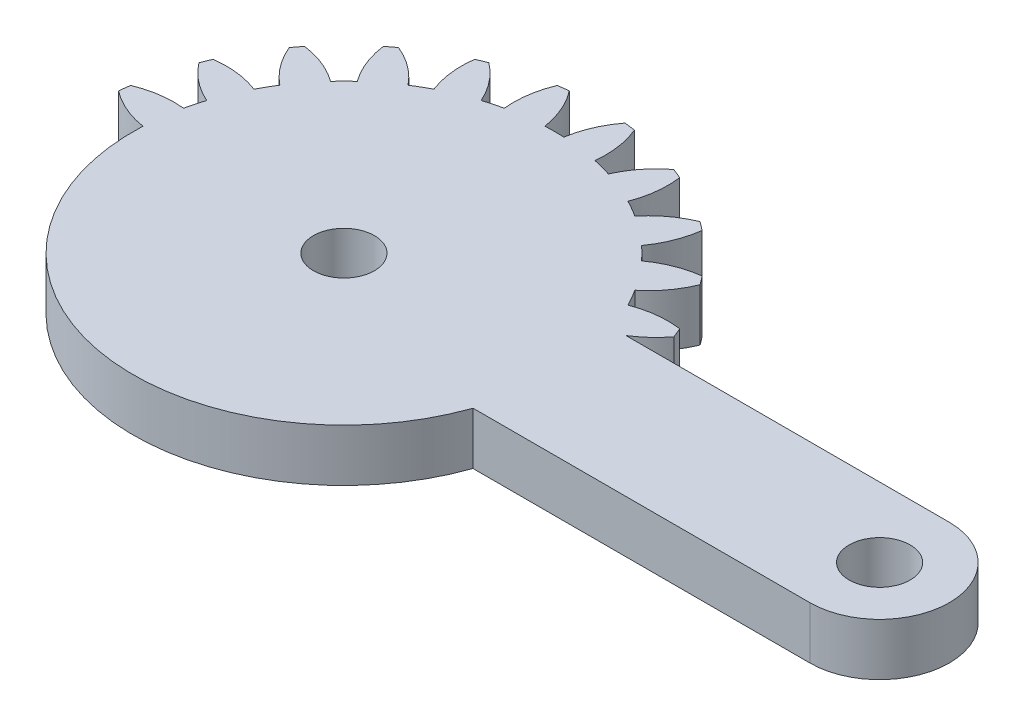
from build123d import *
from build123d.topology import SkipClean

# Parameters (mm, degrees)
SKETCH1_R           = 1.75
BOSS_EXTRUDE1_DEPTH = 3
CUT_EXTRUDE1_START  = -10
CUT_EXTRUDE1_DEPTH  = 10


with BuildPart() as part:
    # Sketch1 → Boss-Extrude1 (new body)
    with BuildSketch(Plane(origin=(0, 0, 0), x_dir=(1, 0, 0), z_dir=(0, 1, 0))):
        with BuildLine():
            Line((20.643657446, 4), (2.081641936, 4))
            ThreePointArc((2.081641936, 4), (2.861028333, 4.588201733), (3.521749436, 5.30713988))
            ThreePointArc((3.521749436, 5.30713988), (3.405395609, 5.596745198), (3.282888305, 5.883801663))
            ThreePointArc((3.282888305, 5.883801663), (1.93527598, 5.894040025), (0.627094961, 5.57027124))
            ThreePointArc((0.627094961, 5.57027124), (0.366286148, 6.046375), (0.084372603, 6.510293938))
            ThreePointArc((0.084372603, 6.510293938), (1.018855105, 7.48132754), (1.683794586, 8.65351323))
            ThreePointArc((1.683794586, 8.65351323), (1.496450048, 8.903135899), (1.303821399, 9.148703928))
            ThreePointArc((1.303821399, 9.148703928), (-0.000522033, 8.809805691), (-1.180330337, 8.158486898))
            ThreePointArc((-1.180330337, 8.158486898), (-1.555477026, 8.550865528), (-1.947855656, 8.926012217))
            ThreePointArc((-1.947855656, 8.926012217), (-1.296536862, 10.105820521), (-0.957638625, 11.410163953))
            ThreePointArc((-0.957638625, 11.410163953), (-1.203206655, 11.602792602), (-1.452829324, 11.79013714))
            ThreePointArc((-1.452829324, 11.79013714), (-2.625015014, 11.125197659), (-3.596048616, 10.190715157))
            ThreePointArc((-3.596048616, 10.190715157), (-4.059967554, 10.472628702), (-4.536071314, 10.733437515))
            ThreePointArc((-4.536071314, 10.733437515), (-4.212302529, 12.041618533), (-4.222540891, 13.389230859))
            ThreePointArc((-4.222540891, 13.389230859), (-4.509597355, 13.511738163), (-4.799202674, 13.62809199))
            ThreePointArc((-4.799202674, 13.62809199), (-5.759348103, 12.682425791), (-6.455432668, 11.528463019))
            ThreePointArc((-6.455432668, 11.528463019), (-6.976508546, 11.680699536), (-7.503891752, 11.809396783))
            ThreePointArc((-7.503891752, 11.809396783), (-7.529737283, 13.156800143), (-7.888414517, 14.455843809))
            ThreePointArc((-7.888414517, 14.455843809), (-8.197396993, 14.499881098), (-8.507248835, 14.537314892))
            ThreePointArc((-8.507248835, 14.537314892), (-9.18992168, 13.375367565), (-9.563620196, 12.080565177))
            ThreePointArc((-9.563620196, 12.080565177), (-10.106342554, 12.09275), (-10.649064912, 12.080565177))
            ThreePointArc((-10.649064912, 12.080565177), (-11.022763428, 13.375367565), (-11.705436272, 14.537314892))
            ThreePointArc((-11.705436272, 14.537314892), (-12.015288115, 14.499881098), (-12.324270591, 14.455843809))
            ThreePointArc((-12.324270591, 14.455843809), (-12.682947825, 13.156800143), (-12.708793355, 11.809396783))
            ThreePointArc((-12.708793355, 11.809396783), (-13.236176561, 11.680699536), (-13.757252439, 11.528463019))
            ThreePointArc((-13.757252439, 11.528463019), (-14.453337005, 12.682425791), (-15.413482434, 13.62809199))
            ThreePointArc((-15.413482434, 13.62809199), (-15.703087752, 13.511738163), (-15.990144217, 13.389230859))
            ThreePointArc((-15.990144217, 13.389230859), (-16.000382579, 12.041618533), (-15.676613793, 10.733437515))
            ThreePointArc((-15.676613793, 10.733437515), (-16.152717554, 10.472628702), (-16.616636492, 10.190715157))
            ThreePointArc((-16.616636492, 10.190715157), (-17.587670094, 11.125197659), (-18.759855783, 11.79013714))
            ThreePointArc((-18.759855783, 11.79013714), (-19.009478453, 11.602792602), (-19.255046482, 11.410163953))
            ThreePointArc((-19.255046482, 11.410163953), (-18.916148245, 10.105820521), (-18.264829452, 8.926012217))
            ThreePointArc((-18.264829452, 8.926012217), (-18.657208082, 8.550865528), (-19.032354771, 8.158486898))
            ThreePointArc((-19.032354771, 8.158486898), (-20.212163074, 8.809805691), (-21.516506507, 9.148703928))
            ThreePointArc((-21.516506507, 9.148703928), (-21.709135156, 8.903135899), (-21.896479694, 8.65351323))
            ThreePointArc((-21.896479694, 8.65351323), (-21.231540213, 7.48132754), (-20.297057711, 6.510293938))
            ThreePointArc((-20.297057711, 6.510293938), (-20.578971255, 6.046375), (-20.839780068, 5.57027124))
            ThreePointArc((-20.839780068, 5.57027124), (-22.147961087, 5.894040025), (-23.495573413, 5.883801663))
            ThreePointArc((-23.495573413, 5.883801663), (-23.618080717, 5.596745198), (-23.734434544, 5.30713988))
            ThreePointArc((-23.734434544, 5.30713988), (-22.788768345, 4.346994451), (-21.634805572, 3.650909885))
            ThreePointArc((-21.634805572, 3.650909885), (-21.78704209, 3.129834008), (-21.915739337, 2.602450802))
            ThreePointArc((-21.915739337, 2.602450802), (-23.263142697, 2.576605271), (-24.562186363, 2.217928037))
            ThreePointArc((-24.562186363, 2.217928037), (-24.606223651, 1.908945561), (-24.643657446, 1.599093719))
            ThreePointArc((-24.643657446, 1.599093719), (-23.481710119, 0.916420874), (-22.186907731, 0.542722358))
            ThreePointArc((-22.186907731, 0.542722358), (-22.199092554, 0), (-22.186907731, -0.542722358))
            ThreePointArc((-22.186907731, -0.542722358), (-23.481710119, -0.916420874), (-24.643657446, -1.599093719))
            ThreePointArc((-24.643657446, -1.599093719), (-24.606223651, -1.908945561), (-24.562186363, -2.217928037))
            ThreePointArc((-24.562186363, -2.217928037), (-23.263142697, -2.576605271), (-21.915739337, -2.602450802))
            ThreePointArc((-21.915739337, -2.602450802), (-21.78704209, -3.129834008), (-21.634805572, -3.650909885))
            ThreePointArc((-21.634805572, -3.650909885), (-22.788768345, -4.346994451), (-23.734434544, -5.30713988))
            ThreePointArc((-23.734434544, -5.30713988), (-23.618080717, -5.596745198), (-23.495573413, -5.883801663))
            ThreePointArc((-23.495573413, -5.883801663), (-22.147961087, -5.894040025), (-20.839780068, -5.57027124))
            ThreePointArc((-20.839780068, -5.57027124), (-20.578971255, -6.046375), (-20.297057711, -6.510293938))
            ThreePointArc((-20.297057711, -6.510293938), (-21.231540213, -7.48132754), (-21.896479694, -8.65351323))
            ThreePointArc((-21.896479694, -8.65351323), (-21.709135156, -8.903135899), (-21.516506507, -9.148703928))
            ThreePointArc((-21.516506507, -9.148703928), (-20.212163074, -8.809805691), (-19.032354771, -8.158486898))
            ThreePointArc((-19.032354771, -8.158486898), (-18.657208082, -8.550865528), (-18.264829452, -8.926012217))
            ThreePointArc((-18.264829452, -8.926012217), (-18.916148245, -10.105820521), (-19.255046482, -11.410163953))
            ThreePointArc((-19.255046482, -11.410163953), (-19.009478453, -11.602792602), (-18.759855783, -11.79013714))
            ThreePointArc((-18.759855783, -11.79013714), (-17.587670094, -11.125197659), (-16.616636492, -10.190715157))
            ThreePointArc((-16.616636492, -10.190715157), (-16.152717554, -10.472628702), (-15.676613793, -10.733437515))
            ThreePointArc((-15.676613793, -10.733437515), (-16.000382579, -12.041618533), (-15.990144217, -13.389230859))
            ThreePointArc((-15.990144217, -13.389230859), (-15.703087752, -13.511738163), (-15.413482434, -13.62809199))
            ThreePointArc((-15.413482434, -13.62809199), (-14.453337005, -12.682425791), (-13.757252439, -11.528463019))
            ThreePointArc((-13.757252439, -11.528463019), (-13.236176561, -11.680699536), (-12.708793355, -11.809396783))
            ThreePointArc((-12.708793355, -11.809396783), (-12.682947825, -13.156800143), (-12.324270591, -14.455843809))
            ThreePointArc((-12.324270591, -14.455843809), (-12.015288115, -14.499881098), (-11.705436272, -14.537314892))
            ThreePointArc((-11.705436272, -14.537314892), (-11.022763428, -13.375367565), (-10.649064912, -12.080565177))
            ThreePointArc((-10.649064912, -12.080565177), (-10.106342554, -12.09275), (-9.563620196, -12.080565177))
            ThreePointArc((-9.563620196, -12.080565177), (-9.18992168, -13.375367565), (-8.507248835, -14.537314892))
            ThreePointArc((-8.507248835, -14.537314892), (-8.197396993, -14.499881098), (-7.888414517, -14.455843809))
            ThreePointArc((-7.888414517, -14.455843809), (-7.529737283, -13.156800143), (-7.503891752, -11.809396783))
            ThreePointArc((-7.503891752, -11.809396783), (-6.976508546, -11.680699536), (-6.455432668, -11.528463019))
            ThreePointArc((-6.455432668, -11.528463019), (-5.759348103, -12.682425791), (-4.799202674, -13.62809199))
            ThreePointArc((-4.799202674, -13.62809199), (-4.509597355, -13.511738163), (-4.222540891, -13.389230859))
            ThreePointArc((-4.222540891, -13.389230859), (-4.212302529, -12.041618533), (-4.536071314, -10.733437515))
            ThreePointArc((-4.536071314, -10.733437515), (-4.059967554, -10.472628702), (-3.596048616, -10.190715157))
            ThreePointArc((-3.596048616, -10.190715157), (-2.625015014, -11.125197659), (-1.452829324, -11.79013714))
            ThreePointArc((-1.452829324, -11.79013714), (-1.203206655, -11.602792602), (-0.957638625, -11.410163953))
            ThreePointArc((-0.957638625, -11.410163953), (-1.296536862, -10.105820521), (-1.947855656, -8.926012217))
            ThreePointArc((-1.947855656, -8.926012217), (-1.555477026, -8.550865528), (-1.180330337, -8.158486898))
            ThreePointArc((-1.180330337, -8.158486898), (-0.000522033, -8.809805691), (1.303821399, -9.148703928))
            ThreePointArc((1.303821399, -9.148703928), (1.496450048, -8.903135899), (1.683794586, -8.65351323))
            ThreePointArc((1.683794586, -8.65351323), (1.018855105, -7.48132754), (0.084372603, -6.510293938))
            ThreePointArc((0.084372603, -6.510293938), (0.366286148, -6.046375), (0.627094961, -5.57027124))
            ThreePointArc((0.627094961, -5.57027124), (1.93527598, -5.894040025), (3.282888305, -5.883801663))
            ThreePointArc((3.282888305, -5.883801663), (3.405395609, -5.596745198), (3.521749436, -5.30713988))
            ThreePointArc((3.521749436, -5.30713988), (2.861028333, -4.588201733), (2.081641936, -4))
            Line((2.081641936, -4), (20.643657446, -4))
            ThreePointArc((20.643657446, -4), (24.643657446, 0), (20.643657446, 4))
        make_face()
        with Locations((-10.106342554, 0)):
            Circle(SKETCH1_R, mode=Mode.SUBTRACT)
        with Locations((20.643657446, 0)):
            Circle(SKETCH1_R, mode=Mode.SUBTRACT)
    extrude(amount=BOSS_EXTRUDE1_DEPTH)

    # Sketch2 → Cut-Extrude1 (cut)
    with SkipClean():  # the faces are left unmerged after this step: merging them gives an invalid solid
        with BuildSketch(Plane(origin=(0, 3, 0), x_dir=(1, 0, 0), z_dir=(0, 1, 0)).offset(CUT_EXTRUDE1_START)):
            with BuildLine():
                ThreePointArc((3.521749436, -5.30713988), (2.861028333, -4.588201733), (2.081641936, -4))
                Line((2.081641936, -4), (1.305695063, -4))
                ThreePointArc((1.305695063, -4), (0.994195953, -4.797149927), (0.627094961, -5.57027124))
                ThreePointArc((0.627094961, -5.57027124), (1.93527598, -5.894040025), (3.282888305, -5.883801663))
                ThreePointArc((3.282888305, -5.883801663), (3.405395609, -5.596745198), (3.521749436, -5.30713988))
            make_face()
            with BuildLine():
                ThreePointArc((1.683794586, -8.65351323), (1.018855105, -7.48132754), (0.084372603, -6.510293938))
                ThreePointArc((0.084372603, -6.510293938), (-0.512518948, -7.361599771), (-1.180330337, -8.158486898))
                ThreePointArc((-1.180330337, -8.158486898), (-0.000522033, -8.809805691), (1.303821399, -9.148703928))
                ThreePointArc((1.303821399, -9.148703928), (1.496450048, -8.903135899), (1.683794586, -8.65351323))
            make_face()
            with BuildLine():
                ThreePointArc((-0.957638625, -11.410163953), (-1.296536862, -10.105820521), (-1.947855656, -8.926012217))
                ThreePointArc((-1.947855656, -8.926012217), (-2.744742783, -9.593823606), (-3.596048616, -10.190715157))
                ThreePointArc((-3.596048616, -10.190715157), (-2.625015014, -11.125197659), (-1.452829324, -11.79013714))
                ThreePointArc((-1.452829324, -11.79013714), (-1.203206655, -11.602792602), (-0.957638625, -11.410163953))
            make_face()
            with BuildLine():
                ThreePointArc((-4.222540891, -13.389230859), (-4.212302529, -12.041618533), (-4.536071314, -10.733437515))
                ThreePointArc((-4.536071314, -10.733437515), (-5.478647477, -11.172244217), (-6.455432668, -11.528463019))
                ThreePointArc((-6.455432668, -11.528463019), (-5.759348103, -12.682425791), (-4.799202674, -13.62809199))
                ThreePointArc((-4.799202674, -13.62809199), (-4.509597355, -13.511738163), (-4.222540891, -13.389230859))
            make_face()
            with BuildLine():
                ThreePointArc((-7.888414517, -14.455843809), (-7.529737283, -13.156800143), (-7.503891752, -11.809396783))
                ThreePointArc((-7.503891752, -11.809396783), (-8.527921943, -11.989294847), (-9.563620196, -12.080565177))
                ThreePointArc((-9.563620196, -12.080565177), (-9.18992168, -13.375367565), (-8.507248835, -14.537314892))
                ThreePointArc((-8.507248835, -14.537314892), (-8.197396993, -14.499881098), (-7.888414517, -14.455843809))
            make_face()
            with BuildLine():
                ThreePointArc((-11.705436272, -14.537314892), (-11.022763428, -13.375367565), (-10.649064912, -12.080565177))
                ThreePointArc((-10.649064912, -12.080565177), (-11.684763165, -11.989294847), (-12.708793355, -11.809396783))
                ThreePointArc((-12.708793355, -11.809396783), (-12.682947825, -13.156800143), (-12.324270591, -14.455843809))
                ThreePointArc((-12.324270591, -14.455843809), (-12.015288115, -14.499881098), (-11.705436272, -14.537314892))
            make_face()
            with BuildLine():
                ThreePointArc((-15.413482434, -13.62809199), (-14.453337005, -12.682425791), (-13.757252439, -11.528463019))
                ThreePointArc((-13.757252439, -11.528463019), (-14.734037631, -11.172244217), (-15.676613793, -10.733437515))
                ThreePointArc((-15.676613793, -10.733437515), (-16.000382579, -12.041618533), (-15.990144217, -13.389230859))
                ThreePointArc((-15.990144217, -13.389230859), (-15.703087752, -13.511738163), (-15.413482434, -13.62809199))
            make_face()
            with BuildLine():
                ThreePointArc((-18.759855783, -11.79013714), (-17.587670094, -11.125197659), (-16.616636492, -10.190715157))
                ThreePointArc((-16.616636492, -10.190715157), (-17.467942324, -9.593823606), (-18.264829452, -8.926012217))
                ThreePointArc((-18.264829452, -8.926012217), (-18.916148245, -10.105820521), (-19.255046482, -11.410163953))
                ThreePointArc((-19.255046482, -11.410163953), (-19.009478453, -11.602792602), (-18.759855783, -11.79013714))
            make_face()
            with BuildLine():
                ThreePointArc((-21.516506507, -9.148703928), (-20.212163074, -8.809805691), (-19.032354771, -8.158486898))
                ThreePointArc((-19.032354771, -8.158486898), (-19.70016616, -7.361599771), (-20.297057711, -6.510293938))
                ThreePointArc((-20.297057711, -6.510293938), (-21.231540213, -7.48132754), (-21.896479694, -8.65351323))
                ThreePointArc((-21.896479694, -8.65351323), (-21.709135156, -8.903135899), (-21.516506507, -9.148703928))
            make_face()
            with BuildLine():
                ThreePointArc((-23.495573413, -5.883801663), (-22.147961087, -5.894040025), (-20.839780068, -5.57027124))
                ThreePointArc((-20.839780068, -5.57027124), (-21.278586771, -4.627695077), (-21.634805572, -3.650909885))
                ThreePointArc((-21.634805572, -3.650909885), (-22.788768345, -4.346994451), (-23.734434544, -5.30713988))
                ThreePointArc((-23.734434544, -5.30713988), (-23.618080717, -5.596745198), (-23.495573413, -5.883801663))
            make_face()
            with BuildLine():
                ThreePointArc((-24.562186363, -2.217928037), (-23.263142697, -2.576605271), (-21.915739337, -2.602450802))
                ThreePointArc((-21.915739337, -2.602450802), (-22.095637401, -1.578420611), (-22.186907731, -0.542722358))
                ThreePointArc((-22.186907731, -0.542722358), (-23.481710119, -0.916420874), (-24.643657446, -1.599093719))
                ThreePointArc((-24.643657446, -1.599093719), (-24.606223651, -1.908945561), (-24.562186363, -2.217928037))
            make_face()
        extrude(amount=CUT_EXTRUDE1_DEPTH, mode=Mode.SUBTRACT)


solid = part.part
